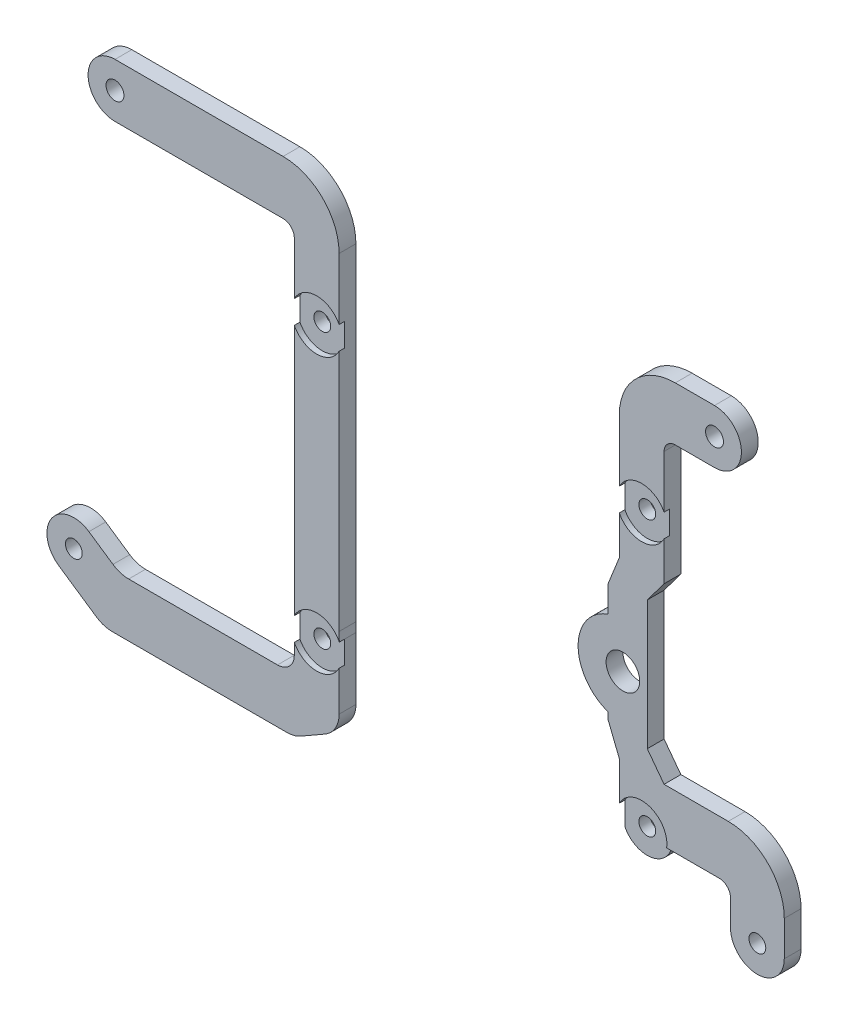
from build123d import *

# Parameters (mm, degrees)
SKETCH1_R            = 4
SKETCH1_R_2          = 1.5
BOSS_EXTRUDE1_DEPTH  = 3
SKETCH3_R            = 4
SKETCH3_R_2          = 1.5
BOSS_EXTRUDE2_DEPTH  = 3
BOSS_EXTRUDE3_START  = -3
SKETCH4_R            = 4.5
SKETCH4_R_2          = 1.5
BOSS_EXTRUDE3_DEPTH  = 3
BOSS_EXTRUDE4_START  = -3
SKETCH6_R            = 4.5
SKETCH6_R_2          = 1.5
BOSS_EXTRUDE4_DEPTH  = 3
SKETCH7_R            = 4.5
CUT_EXTRUDE1_DEPTH   = 1
BOSS_EXTRUDE5_START  = -2
SKETCH8_R            = 4.5
BOSS_EXTRUDE5_DEPTH  = 2
CUT_EXTRUDE2_DEPTH   = 1
SKETCH11_R           = 4.5
SKETCH11_R_2         = 1.5
BOSS_EXTRUDE6_DEPTH  = 3
CUT_EXTRUDE3_DEPTH   = 10
FILLET1_R            = 15
SKETCH13_R           = 4.5
CUT_EXTRUDE4_DEPTH   = 1
SKETCH14_R           = 2.8
CUT_EXTRUDE5_DEPTH   = 1
CUT_EXTRUDE6_DEPTH   = 10
SKETCH17_R           = 4.8
SKETCH17_R_2         = 2.8
SKETCH17_R_3         = 1.5
BOSS_EXTRUDE7_DEPTH  = 2
CUT_EXTRUDE7_DEPTH   = 10
BOSS_EXTRUDE9_DEPTH  = 2
BOSS_EXTRUDE10_START = 1
SKETCH20_R           = 1.5
BOSS_EXTRUDE10_DEPTH = 1
FILLET2_R            = 2
FILLET3_R            = 10
BOSS_EXTRUDE11_DEPTH = 3
CUT_EXTRUDE8_DEPTH   = 74.037695747
BOSS_EXTRUDE13_DEPTH = 3
CUT_EXTRUDE9_START   = 27
SKETCH23_R           = 4.5
CUT_EXTRUDE9_DEPTH   = 27
SKETCH24_R           = 1.6
BOSS_EXTRUDE14_DEPTH = 3
CUT_EXTRUDE10_DEPTH  = 80.647379116
FILLET4_R            = 2
FILLET5_R            = 10
SKETCH26_R           = 1.6
BOSS_EXTRUDE15_DEPTH = 3
FILLET6_R            = 2
FILLET7_R            = 10
BOSS_EXTRUDE16_DEPTH = 3
SKETCH28_R           = 4.8
SKETCH28_R_2         = 1.5
BOSS_EXTRUDE17_DEPTH = 3
CUT_EXTRUDE11_DEPTH  = 10
BOSS_EXTRUDE18_DEPTH = 3
FILLET10_R           = 3
FILLET11_R           = 5


with BuildPart() as part:
    # Sketch1 → Boss-Extrude1 (new body)
    # profile 1 of 3: a face of its own
    with BuildSketch(Plane.XY):
        with BuildLine():
            Line((42, 16), (42, 25))
            ThreePointArc((42, 25), (38, 21), (34, 25))
            Line((34, 25), (34, 16))
            Line((34, 16), (32, 11))
            Line((32, 11), (32, -10))
            Line((32, -10), (34, -15))
            Line((34, -15), (34, -24))
            ThreePointArc((34, -24), (38, -20), (42, -24))
            Line((42, -24), (42, -15))
            Line((42, -15), (39, -11))
            Line((39, -11), (39, 12))
            Line((39, 12), (42, 16))
        make_face()
    # profile 2 of 3: a face of its own
    with BuildSketch(Plane.XY):
        with Locations((38, 25)):
            Circle(SKETCH1_R)
        with Locations((38, 25)):
            Circle(SKETCH1_R_2, mode=Mode.SUBTRACT)
    # profile 3 of 3: a face of its own
    with BuildSketch(Plane.XY):
        with Locations((38, -24)):
            Circle(SKETCH1_R)
        with Locations((38, -24)):
            Circle(SKETCH1_R_2, mode=Mode.SUBTRACT)
    extrude(amount=BOSS_EXTRUDE1_DEPTH)

    # Sketch4 → Boss-Extrude3 (add)
    # profile 1 of 2: a face of its own
    with BuildSketch(Plane.XY.offset(3).offset(BOSS_EXTRUDE3_START)):
        with BuildLine():
            Line((41.611961927, 26.718642207), (38.389507789, 40.991070821))
            ThreePointArc((38.389507789, 40.991070821), (38.472291641, 40.498605531), (38.5, 40))
            ThreePointArc((38.5, 40), (34.682909647, 35.552120234), (29.707273594, 38.65))
            Line((29.707273594, 38.65), (34, 25))
            ThreePointArc((34, 25), (37.119048159, 28.901784701), (41.611961927, 26.718642207))
        make_face()
    # profile 2 of 2: a face of its own
    with BuildSketch(Plane.XY.offset(3).offset(BOSS_EXTRUDE3_START)):
        with Locations((34, 40)):
            Circle(SKETCH4_R)
        with Locations((34, 40)):
            Circle(SKETCH4_R_2, mode=Mode.SUBTRACT)
    extrude(amount=BOSS_EXTRUDE3_DEPTH)

    # Sketch6 → Boss-Extrude4 (add)
    # profile 1 of 2: a face of its own
    with BuildSketch(Plane.XY.offset(3).offset(BOSS_EXTRUDE4_START)):
        with BuildLine():
            ThreePointArc((41.871336735, -25.006355743), (37.492726377, -27.967703803), (34, -24))
            Line((34, -24), (29.058763693, -54.27514135))
            ThreePointArc((29.058763693, -54.27514135), (33.863618356, -50.514714982), (38, -55))
            ThreePointArc((38, -55), (37.990907509, -55.285919128), (37.963666779, -55.570682826))
            Line((37.963666779, -55.570682826), (41.871336735, -25.006355743))
        make_face()
    # profile 2 of 2: a face of its own
    with BuildSketch(Plane.XY.offset(3).offset(BOSS_EXTRUDE4_START)):
        with Locations((33.5, -55)):
            Circle(SKETCH6_R)
        with Locations((33.5, -55)):
            Circle(SKETCH6_R_2, mode=Mode.SUBTRACT)
    extrude(amount=BOSS_EXTRUDE4_DEPTH)

    # Sketch7 → Cut-Extrude1 (cut)
    with BuildSketch(Plane.XY.offset(3)):
        with Locations((38, -24)):
            Circle(SKETCH7_R)
        with Locations((38, 25)):
            Circle(SKETCH7_R)
    extrude(amount=-CUT_EXTRUDE1_DEPTH, mode=Mode.SUBTRACT)

    # Sketch8 → Boss-Extrude5 (add)
    # profile 1 of 2: a face of its own
    with BuildSketch(Plane.XY.offset(BOSS_EXTRUDE5_START)):
        with Locations((33.5, -55)):
            Circle(SKETCH8_R)
        Polygon((34.020796686, -51.80905905), (30.996962418, -52.953506365), (30.476165733, -56.144447315), (32.979203314, -58.19094095), (36.003037582, -57.046493635), (36.523834267, -53.855552685), align=None, mode=Mode.SUBTRACT)
    # profile 2 of 2: a face of its own
    with BuildSketch(Plane.XY.offset(BOSS_EXTRUDE5_START)):
        with Locations((34, 40)):
            Circle(SKETCH8_R)
        Polygon((34.712064895, 36.846224973), (37.087281738, 39.039778775), (36.375216843, 42.193553802), (33.287935105, 43.153775027), (30.912718262, 40.960221225), (31.624783157, 37.806446198), align=None, mode=Mode.SUBTRACT)
    extrude(amount=BOSS_EXTRUDE5_DEPTH)

    # Sketch9 → Cut-Extrude2 (cut)
    with BuildSketch(Plane.XY):
        Polygon((31.624783157, 37.806446198), (34.712064895, 36.846224973), (37.087281738, 39.039778775), (36.375216843, 42.193553802), (33.287935105, 43.153775027), (30.912718262, 40.960221225), align=None)
        Polygon((36.523834267, -53.855552685), (34.020796686, -51.80905905), (30.996962418, -52.953506365), (30.476165733, -56.144447315), (32.979203314, -58.19094095), (36.003037582, -57.046493635), align=None)
    extrude(amount=CUT_EXTRUDE2_DEPTH, mode=Mode.SUBTRACT)


with BuildPart() as body_2:
    # Sketch3 → Boss-Extrude2 (new body)
    # profile 1 of 5: a face of its own
    with BuildSketch(Plane(origin=(0, 0, 0), x_dir=(-1, 0, 0), z_dir=(0, 0, -1))):
        with BuildLine():
            Line((16, 48.652065436), (16, 25.000000006))
            ThreePointArc((16, 25.000000006), (20.000000003, 29), (24, 25))
            Line((24, 25), (24, 48.652065436))
            Line((24, 48.652065436), (16, 48.652065436))
        make_face()
    # profile 2 of 5: a face of its own
    with BuildSketch(Plane(origin=(0, 0, 0), x_dir=(-1, 0, 0), z_dir=(0, 0, -1))):
        with BuildLine():
            Line((16, 25.000000006), (16, -24))
            ThreePointArc((16, -24), (20, -20), (24, -24))
            Line((24, -24), (24, 25))
            ThreePointArc((24, 25), (19.999999997, 21), (16, 25.000000006))
        make_face()
    # profile 3 of 5: a face of its own
    with BuildSketch(Plane(origin=(0, 0, 0), x_dir=(-1, 0, 0), z_dir=(0, 0, -1))):
        with Locations((20, 25)):
            Circle(SKETCH3_R)
        with Locations((20, 25)):
            Circle(SKETCH3_R_2, mode=Mode.SUBTRACT)
    # profile 4 of 5: a face of its own
    with BuildSketch(Plane(origin=(0, 0, 0), x_dir=(-1, 0, 0), z_dir=(0, 0, -1))):
        with Locations((20, -24)):
            Circle(SKETCH3_R)
        with Locations((20, -24)):
            Circle(SKETCH3_R_2, mode=Mode.SUBTRACT)
    # profile 5 of 5: a face of its own
    with BuildSketch(Plane(origin=(0, 0, 0), x_dir=(-1, 0, 0), z_dir=(0, 0, -1))):
        with BuildLine():
            Line((16, -24), (16, -47.652065436))
            Line((16, -47.652065436), (24, -47.652065436))
            Line((24, -47.652065436), (24, -24))
            ThreePointArc((24, -24), (20, -28), (16, -24))
        make_face()
    extrude(amount=-BOSS_EXTRUDE2_DEPTH)

    # Sketch11 → Boss-Extrude6 (add)
    # profile 1 of 4: a face of its own
    with BuildSketch(Plane(origin=(0, 0, 0), x_dir=(-1, 0, 0), z_dir=(0, 0, -1))):
        with BuildLine():
            Line((16, 27.514718626), (16, 44.462274403))
            ThreePointArc((16, 44.462274403), (13.830389495, 45.741768871), (11.519982105, 46.744930638))
            ThreePointArc((11.519982105, 46.744930638), (13.670125556, 45.097725276), (14.485281374, 42.514718626))
            ThreePointArc((14.485281374, 42.514718626), (12.568288024, 38.829874444), (8.450580643, 38.284506614))
            ThreePointArc((8.450580643, 38.284506614), (13.924677223, 34.09085096), (16, 27.514718626))
        make_face()
    # profile 2 of 4: a face of its own
    with BuildSketch(Plane(origin=(0, 0, 0), x_dir=(-1, 0, 0), z_dir=(0, 0, -1))):
        with Locations((9.985281374, 42.514718626)):
            Circle(SKETCH11_R)
        with Locations((9.985281374, 42.514718626)):
            Circle(SKETCH11_R_2, mode=Mode.SUBTRACT)
    # profile 3 of 4: a face of its own
    with BuildSketch(Plane(origin=(0, 0, 0), x_dir=(-1, 0, 0), z_dir=(0, 0, -1))):
        with BuildLine():
            ThreePointArc((5.085019105, -58.683432669), (11.122941196, -53.637894787), (16.230171628, -47.652065436))
            Line((16.230171628, -47.652065436), (16, -47.652065436))
            Line((16, -47.652065436), (16, -20.377310968))
            ThreePointArc((16, -20.377310968), (11.738518343, -37.812658856), (-0.085019105, -51.316567331))
            ThreePointArc((-0.085019105, -51.316567331), (4.575742521, -51.007345121), (7, -55))
            ThreePointArc((7, -55), (6.492654879, -57.075742521), (5.085019105, -58.683432669))
        make_face()
    # profile 4 of 4: a face of its own
    with BuildSketch(Plane(origin=(0, 0, 0), x_dir=(-1, 0, 0), z_dir=(0, 0, -1))):
        with Locations((2.5, -55)):
            Circle(SKETCH11_R)
        with Locations((2.5, -55)):
            Circle(SKETCH11_R_2, mode=Mode.SUBTRACT)
    extrude(amount=-BOSS_EXTRUDE6_DEPTH)

    # Sketch11<3> → Cut-Extrude3 (cut)
    with BuildSketch(Plane(origin=(0, 0, 0), x_dir=(-1, 0, 0), z_dir=(0, 0, -1))):
        with BuildLine():
            Line((16.230171628, -47.652065436), (24, -47.652065436))
            Line((24, -47.652065436), (24, -30))
            ThreePointArc((24, -30), (21.034294866, -39.230636734), (16.230171628, -47.652065436))
        make_face()
        with BuildLine():
            ThreePointArc((16, 44.462274403), (20.888273047, 39.815856602), (24, 33.832415523))
            Line((24, 33.832415523), (24, 48.652065436))
            Line((24, 48.652065436), (16, 48.652065436))
            Line((16, 48.652065436), (16, 44.462274403))
        make_face()
    extrude(amount=-CUT_EXTRUDE3_DEPTH, mode=Mode.SUBTRACT)

    # Fillet1
    fillet1_edges = [body_2.edges().sort_by_distance(p)[0] for p in [
        (-24, -30, 1.5),
        (-24, 33.832415523, 1.5),
    ]]
    fillet(fillet1_edges, radius=FILLET1_R)

    # Sketch13 → Cut-Extrude4 (cut)
    with BuildSketch(Plane.XY.offset(3)):
        with Locations((-20, 25)):
            Circle(SKETCH13_R)
        with Locations((-20, -24)):
            Circle(SKETCH13_R)
    extrude(amount=-CUT_EXTRUDE4_DEPTH, mode=Mode.SUBTRACT)

    # Sketch14 → Cut-Extrude5 (cut)
    with BuildSketch(Plane.XY):
        with Locations((-9.985281374, 42.514718626)):
            Circle(SKETCH14_R)
        with Locations((-2.5, -55)):
            Circle(SKETCH14_R)
    extrude(amount=CUT_EXTRUDE5_DEPTH, mode=Mode.SUBTRACT)


with BuildPart() as cut_extrude6_tool:
    # Sketch16 → Cut-Extrude6 (new body)
    with BuildSketch(Plane.XY.offset(3)):
        Polygon((-16, 30.663257031), (-24, 30.663257031), (-24, 50.56831031), (-1.716420621, 50.56831031), (-1.716420621, 28.39303204), (-16, 27.061552813), align=None)
        Polygon((42, 30.663257031), (34, 30.663257031), (25.237418799, 30.663257031), (25.237418799, 48.578351607), (45.435435347, 48.578351607), (45.435435347, 22.938447187), (42, 22.938447187), align=None)
        Polygon((25.237418799, 30.663257031), (25.237418799, 22.938447187), (34, 25), (34, 30.663257031), align=None)
        Polygon((23.407781263, -41.193839321), (34, -21.938447187), (34, -29.242024032), (42.469363363, -29.242024032), (42.469363363, -67.614426645), (23.407781263, -67.614426645), align=None)
        with BuildLine():
            Line((-16, -32.135615049), (-24, -32.135615049))
            Line((-24, -32.135615049), (-24, -67.614426645))
            Line((-24, -67.614426645), (10.617937566, -67.614426645))
            Line((10.617937566, -67.614426645), (10.617937566, -31.417618327))
            Line((10.617937566, -31.417618327), (-16, -20.377310968))
            ThreePointArc((-16, -20.377310968), (-15.991198464, -21.192960823), (-15.964797957, -22.008230819))
            ThreePointArc((-15.964797957, -22.008230819), (-15.982247468, -21.973262575), (-16, -21.938447187))
            Line((-16, -21.938447187), (-16, -32.135615049))
        make_face()
    extrude(amount=-CUT_EXTRUDE6_DEPTH)


with BuildPart() as part_1:
    add(part.part)

    # Cut-Extrude6: cut by cut_extrude6_tool
    add(cut_extrude6_tool.part, mode=Mode.SUBTRACT)

    # Sketch17 → Boss-Extrude7 (add)
    # profile 1 of 3: a face of its own
    with BuildSketch(Plane.XY.offset(2)):
        with BuildLine():
            ThreePointArc((53.85, -31.25), (58.65, -26.45), (63.45, -31.25))
            Line((63.45, -31.25), (63.45, -15))
            Line((63.45, -15), (42, -15))
            Line((42, -15), (42, -21.938447187))
            Line((42, -21.938447187), (42, -24))
            Line((42, -24), (42, -24.6))
            Line((42, -24.6), (53.85, -24.6))
            Line((53.85, -24.6), (53.85, -31.25))
        make_face()
    # profile 2 of 3: a face of its own
    with BuildSketch(Plane.XY.offset(2)):
        with Locations((58.65, -31.25)):
            Circle(SKETCH17_R)
        with Locations((58.65, -31.25)):
            Circle(SKETCH17_R_2, mode=Mode.SUBTRACT)
    # profile 3 of 3: a face of its own
    with BuildSketch(Plane.XY.offset(2)):
        with Locations((58.65, -31.25)):
            Circle(SKETCH17_R_2)
        with Locations((58.65, -31.25)):
            Circle(SKETCH17_R_3, mode=Mode.SUBTRACT)
    extrude(amount=-BOSS_EXTRUDE7_DEPTH)

    # Sketch18 → Cut-Extrude7 (cut)
    with BuildSketch(Plane.XY.offset(3)):
        with BuildLine():
            Line((41.329803671, -29.242024032), (41.666426992, -26.60908281))
            ThreePointArc((41.666426992, -26.60908281), (37.679430176, -28.488567142), (34, -26.061552813))
            Line((34, -26.061552813), (34, -29.242024032))
            Line((34, -29.242024032), (41.329803671, -29.242024032))
        make_face()
        with BuildLine():
            Line((34, -29.242024032), (34, -26.061552813))
            Line((34, -26.061552813), (32.029569101, -30.819040511))
            Line((32.029569101, -30.819040511), (38, -35.971767702))
            Line((38, -35.971767702), (45.770174944, -27.740787904))
            Line((45.770174944, -27.740787904), (42.459820624, -24.6))
            ThreePointArc((42.459820624, -24.6), (42.185460371, -25.652852529), (41.666426992, -26.60908281))
            Line((41.666426992, -26.60908281), (41.329803671, -29.242024032))
            Line((41.329803671, -29.242024032), (34, -29.242024032))
        make_face()
    extrude(amount=-CUT_EXTRUDE7_DEPTH, mode=Mode.SUBTRACT)

    # Sketch19 → Boss-Extrude9 (add)
    with BuildSketch(Plane.XY.offset(2)):
        with BuildLine():
            ThreePointArc((42, -21.938447187), (41.923417629, -21.796186463), (41.841777833, -21.656766533))
            Line((41.841777833, -21.656766533), (40.412386546, -27.798735468))
            ThreePointArc((40.412386546, -27.798735468), (41.097065041, -27.26468806), (41.666426992, -26.60908281))
            Line((41.666426992, -26.60908281), (41.871336735, -25.006355743))
            ThreePointArc((41.871336735, -25.006355743), (41.967703803, -24.507273623), (42, -24))
            Line((42, -24), (42, -24.6))
            Line((42, -24.6), (42.459820624, -24.6))
            ThreePointArc((42.459820624, -24.6), (42.434310216, -23.23391064), (42, -21.938447187))
        make_face()
        with BuildLine():
            Line((41.871336735, -25.006355743), (41.666426992, -26.60908281))
            ThreePointArc((41.666426992, -26.60908281), (42.185460371, -25.652852529), (42.459820624, -24.6))
            Line((42.459820624, -24.6), (42, -24.6))
            Line((42, -24.6), (42, -24))
            ThreePointArc((42, -24), (41.967703803, -24.507273623), (41.871336735, -25.006355743))
        make_face()
    extrude(amount=-BOSS_EXTRUDE9_DEPTH)

    # Sketch20 → Boss-Extrude10 (add)
    with BuildSketch(Plane.XY.offset(2).offset(BOSS_EXTRUDE10_START)):
        with BuildLine():
            ThreePointArc((53.85, -31.25), (58.65, -36.05), (63.45, -31.25))
            Line((63.45, -31.25), (63.45, -15))
            Line((63.45, -15), (42, -15))
            Line((42, -15), (42, -21.938447187))
            ThreePointArc((42, -21.938447187), (42.373213921, -22.939339828), (42.5, -24))
            ThreePointArc((42.5, -24), (42.48994392, -24.300671907), (42.459820624, -24.6))
            Line((42.459820624, -24.6), (53.85, -24.6))
            Line((53.85, -24.6), (53.85, -31.25))
        make_face()
        with Locations((58.65, -31.25)):
            Circle(SKETCH20_R, mode=Mode.SUBTRACT)
    extrude(amount=-BOSS_EXTRUDE10_DEPTH)

    # Fillet2
    # the kernel refuses this fillet: 2 mm, written as the material it adds along each edge
    with BuildSketch(Plane(origin=(53.85, -24.6, 2), x_dir=(0, -1, 0), z_dir=(0, 0, -1))) as fillet2_piece_1:
        with BuildLine():
            CenterArc((FILLET2_R, FILLET2_R), FILLET2_R, 180, 90)
            Line((0, FILLET2_R), (0, 0))
            Line((0, 0), (FILLET2_R, 0))
        make_face()
    extrude(amount=2)
    with BuildSketch(Plane(origin=(42.459820624, -24.6, 0), x_dir=(1, 0, 0), z_dir=(0, 0, 1))) as fillet2_piece_2:
        with BuildLine():
            CenterArc((1.497527779, -2), FILLET2_R, 90, 66.421821522)
            ThreePointArc((-0.335502499, -1.2), (-0.126016346, -0.61166847), (0, 0))
            Line((0, 0), (1.497527779, 0))
        make_face()
    extrude(amount=2)
    with BuildSketch(Plane(origin=(53.85, -24.6, 3), x_dir=(0, -1, 0), z_dir=(0, 0, -1))) as fillet2_piece_3:
        with BuildLine():
            CenterArc((FILLET2_R, FILLET2_R), FILLET2_R, 180, 90)
            Line((0, FILLET2_R), (0, 0))
            Line((0, 0), (FILLET2_R, 0))
        make_face()
    extrude(amount=1)

    # Fillet3
    fillet3_edges = [part_1.edges().sort_by_distance(p)[0] for p in [
        (63.45, -15, 1.5),
    ]]
    fillet(fillet3_edges, radius=FILLET3_R)

    # Sketch21 → Boss-Extrude11 (add)
    with BuildSketch(Plane.XY.offset(3)):
        with BuildLine():
            ThreePointArc((42.65, -1.25), (41.678513356, 2.570994635), (39, 5.463977956))
            Line((39, 5.463977956), (39, -7.963977956))
            ThreePointArc((39, -7.963977956), (41.678513356, -5.070994635), (42.65, -1.25))
        make_face()
        with BuildLine():
            ThreePointArc((32, -2.656236111), (31.65, -1.25), (32, 0.156236111))
            Line((32, 0.156236111), (32, 6.298344189))
            ThreePointArc((32, 6.298344189), (26.65, -1.25), (32, -8.798344189))
            Line((32, -8.798344189), (32, -2.656236111))
        make_face()
        with BuildLine():
            ThreePointArc((32, -2.656236111), (35.374568837, -4.161185326), (37.65, -1.25))
            ThreePointArc((37.65, -1.25), (35.374568837, 1.661185326), (32, 0.156236111))
            Line((32, 0.156236111), (32, -2.656236111))
        make_face()
        with BuildLine():
            Line((32, -2.656236111), (32, 0.156236111))
            ThreePointArc((32, 0.156236111), (31.65, -1.25), (32, -2.656236111))
        make_face()
    extrude(amount=-BOSS_EXTRUDE11_DEPTH)

    # Sketch21<3> → Cut-Extrude8 (cut, through all)
    with BuildSketch(Plane.XY.offset(3)):
        with BuildLine():
            ThreePointArc((32, -2.656236111), (35.374568837, -4.161185326), (37.65, -1.25))
            ThreePointArc((37.65, -1.25), (35.374568837, 1.661185326), (32, 0.156236111))
            Line((32, 0.156236111), (32, -2.656236111))
        make_face()
        with BuildLine():
            Line((32, -2.656236111), (32, 0.156236111))
            ThreePointArc((32, 0.156236111), (31.65, -1.25), (32, -2.656236111))
        make_face()
    extrude(amount=-CUT_EXTRUDE8_DEPTH, mode=Mode.SUBTRACT)

    # Sketch22 → Boss-Extrude13 (add)
    with BuildSketch(Plane.XY.offset(3)):
        Polygon((42, 22.938447187), (42, 30.663257031), (38.94848837, 30.663257031), (40.750845264, 20.433528286), (42, 20.872691791), align=None)
    extrude(amount=-BOSS_EXTRUDE13_DEPTH)

    # Sketch23 → Cut-Extrude9 (cut)
    with BuildSketch(Plane.XY.offset(2).offset(CUT_EXTRUDE9_START)):
        with Locations((38, 25)):
            Circle(SKETCH23_R)
    extrude(amount=-CUT_EXTRUDE9_DEPTH, mode=Mode.SUBTRACT)

    # Sketch24 → Boss-Extrude14 (add)
    with BuildSketch(Plane.XY.offset(3)):
        with BuildLine():
            Line((42, 38.45), (51, 38.45))
            ThreePointArc((51, 38.45), (55.8, 43.25), (51, 48.05))
            Line((51, 48.05), (34, 48.05))
            Line((34, 48.05), (34, 30.663257031))
            Line((34, 30.663257031), (42, 30.663257031))
            Line((42, 30.663257031), (42, 38.45))
        make_face()
        with Locations((51, 43.25)):
            Circle(SKETCH24_R, mode=Mode.SUBTRACT)
    extrude(amount=-BOSS_EXTRUDE14_DEPTH)

    # Sketch25 → Cut-Extrude10 (cut, through all)
    with BuildSketch(Plane.XY.offset(3)):
        Polygon((39, 5.463977956), (39, -7.963977956), (43.892549403, -7.026039412), (43.892549403, 5.463977956), align=None)
    extrude(amount=-CUT_EXTRUDE10_DEPTH, mode=Mode.SUBTRACT)

    # Fillet4
    fillet4_edges = [part_1.edges().sort_by_distance(p)[0] for p in [
        (42, 38.45, 1.5),
    ]]
    fillet(fillet4_edges, radius=FILLET4_R)

    # Fillet5
    fillet5_edges = [part_1.edges().sort_by_distance(p)[0] for p in [
        (34, 48.05, 1.5),
    ]]
    fillet(fillet5_edges, radius=FILLET5_R)


with BuildPart() as body_2_1:
    add(body_2.part)

    # Cut-Extrude6: cut by cut_extrude6_tool
    add(cut_extrude6_tool.part, mode=Mode.SUBTRACT)

    # Sketch26 → Boss-Extrude15 (add)
    with BuildSketch(Plane.XY.offset(3)):
        with BuildLine():
            Line((-16, 48.05), (-56, 48.05))
            ThreePointArc((-56, 48.05), (-60.8, 43.25), (-56, 38.45))
            Line((-56, 38.45), (-24, 38.45))
            Line((-24, 38.45), (-24, 30.663257031))
            Line((-24, 30.663257031), (-16, 30.663257031))
            Line((-16, 30.663257031), (-16, 48.05))
        make_face()
        with Locations((-56, 43.25)):
            Circle(SKETCH26_R, mode=Mode.SUBTRACT)
    extrude(amount=-BOSS_EXTRUDE15_DEPTH)

    # Fillet6
    fillet6_edges = [body_2_1.edges().sort_by_distance(p)[0] for p in [
        (-24, 38.45, 1.5),
    ]]
    fillet(fillet6_edges, radius=FILLET6_R)

    # Fillet7
    fillet7_edges = [body_2_1.edges().sort_by_distance(p)[0] for p in [
        (-16, 48.05, 1.5),
    ]]
    fillet(fillet7_edges, radius=FILLET7_R)

    # Sketch27 → Boss-Extrude16 (add)
    with BuildSketch(Plane.XY.offset(3)):
        Polygon((-24, -28.289083475), (-24, -32.135615049), (-21.706055942, -32.135615049), align=None)
    extrude(amount=-BOSS_EXTRUDE16_DEPTH)

    # Sketch28 → Boss-Extrude17 (add)
    # profile 1 of 2: a face of its own
    with BuildSketch(Plane.XY.offset(3)):
        with BuildLine():
            ThreePointArc((-58.55, -31.25), (-59.95588745, -34.64411255), (-63.35, -36.05))
            Line((-63.35, -36.05), (-16, -36.05))
            Line((-16, -36.05), (-16, -32.135615049))
            Line((-16, -32.135615049), (-24, -32.135615049))
            Line((-24, -32.135615049), (-24, -26.45))
            Line((-24, -26.45), (-63.35, -26.45))
            ThreePointArc((-63.35, -26.45), (-59.95588745, -27.85588745), (-58.55, -31.25))
        make_face()
    # profile 2 of 2: a face of its own
    with BuildSketch(Plane.XY.offset(3)):
        with Locations((-63.35, -31.25)):
            Circle(SKETCH28_R)
        with Locations((-63.35, -31.25)):
            Circle(SKETCH28_R_2, mode=Mode.SUBTRACT)
    extrude(amount=-BOSS_EXTRUDE17_DEPTH)

    # Sketch30 → Cut-Extrude11 (cut)
    with BuildSketch(Plane.XY.offset(3)):
        with BuildLine():
            Line((-24, -31.05), (-24, -26.45))
            Line((-24, -26.45), (-63.35, -26.45))
            ThreePointArc((-63.35, -26.45), (-61.940336374, -26.661661688), (-60.654994325, -27.277979807))
            Line((-60.654994325, -27.277979807), (-55.095621849, -31.05))
            Line((-55.095621849, -31.05), (-24, -31.05))
        make_face()
    extrude(amount=-CUT_EXTRUDE11_DEPTH, mode=Mode.SUBTRACT)

    # Sketch30<3> → Boss-Extrude18 (add)
    with BuildSketch(Plane.XY.offset(3)):
        with BuildLine():
            ThreePointArc((-63.35, -36.05), (-64.759663626, -35.838338312), (-66.045005675, -35.222020193))
            Line((-66.045005675, -35.222020193), (-58.045005675, -40.65))
            Line((-58.045005675, -40.65), (-24, -40.65))
            Line((-24, -40.65), (-16, -36.05))
            Line((-16, -36.05), (-63.35, -36.05))
        make_face()
    extrude(amount=-BOSS_EXTRUDE18_DEPTH)

    # Fillet10
    fillet10_edges = [body_2_1.edges().sort_by_distance(p)[0] for p in [
        (-24, -31.05, 1.5),
    ]]
    fillet(fillet10_edges, radius=FILLET10_R)

    # Fillet11
    fillet11_edges = [body_2_1.edges().sort_by_distance(p)[0] for p in [
        (-16, -36.05, 1.5),
        (-55.095621849, -31.05, 1.5),
        (-58.045005675, -40.65, 1.5),
        (-24, -40.65, 1.5),
    ]]
    fillet(fillet11_edges, radius=FILLET11_R)


solid = Compound([part_1.part, body_2_1.part])
